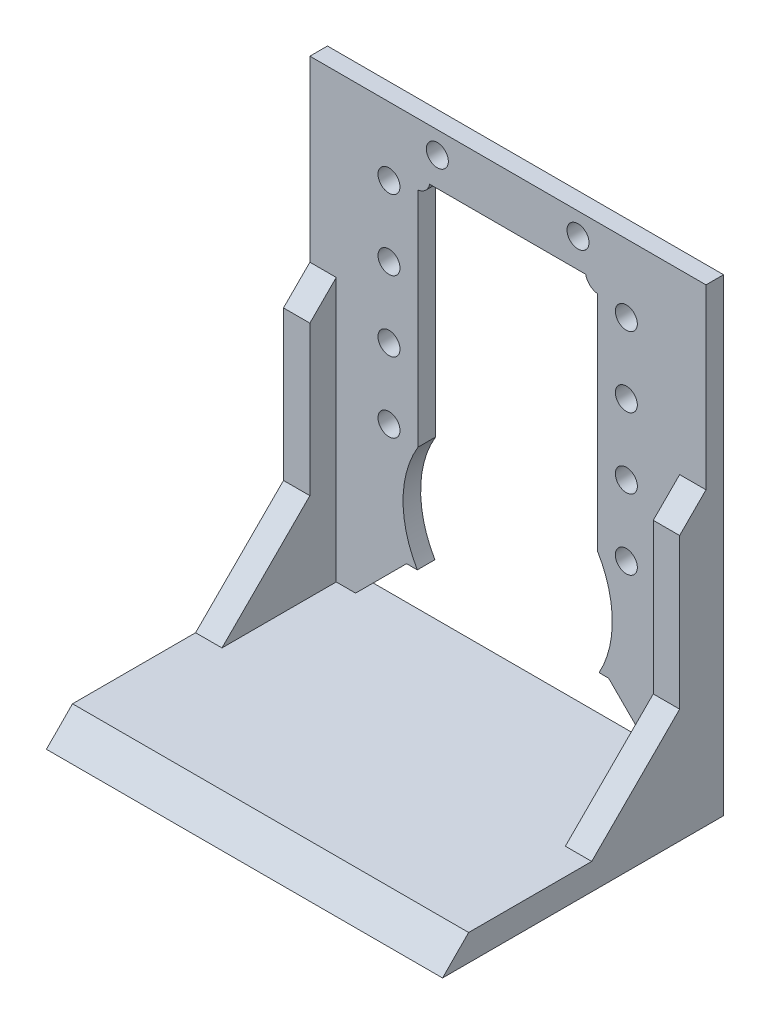
from build123d import *
from OCP.BRepFilletAPI import BRepFilletAPI_MakeChamfer
from build123d.topology import SkipClean

# Parameters (mm, degrees)
SZKIC2_R                         = 1.25
DODANIE_WYCI_GNI_CIE2_DEPTH      = 2
DODANIE_WYCI_GNI_CIE3_DEPTH      = 3
DODANIE_WYCI_GNI_CIE3_DEPTH_BACK = 2
SZKIC3_W                         = 6
SZKIC3_H                         = 30
DODANIE_WYCI_GNI_CIE4_DEPTH      = 30
DODANIE_WYCI_GNI_CIE4_DEPTH_BACK = 2
SZKIC4_W                         = 6
SZKIC4_H                         = 3
SFAZOWANIE1_SIZE                 = 8
SFAZOWANIE1_SIZE2                = 7.929766182
SFAZOWANIE1_SIZE2_2              = 8.072133677
SFAZOWANIE2_SIZE                 = 10
SFAZOWANIE3_SIZE                 = 3
SZKIC5_W                         = 38.5
SZKIC5_H                         = 53.3
SZKIC5_W_2                       = 38.438336307
SZKIC5_H_2                       = 53.191798748
WYTNIJ_WYCI_GNI_CIE1_DEPTH       = 48.5
DODANIE_WYCI_GNI_CIE5_DEPTH      = 42.061663693
WYTNIJ_WYCI_GNI_CIE2_DEPTH       = 50.5


with BuildPart() as part:
    # Szkic2 → Dodanie-wyciągnięcie2 (new body)
    with BuildSketch(Plane.XY):
        with BuildLine():
            Line((-191.460111356, 62.995312244), (-303.460111356, 62.995312244))
            Line((-303.460111356, 62.995312244), (-308.460111356, 57.995312244))
            Line((-308.460111356, 57.995312244), (-308.460111356, 23.495312244))
            Line((-308.460111356, 23.495312244), (-303.460111356, 18.495312244))
            Line((-303.460111356, 18.495312244), (-302.736783969, 18.495312244))
            ThreePointArc((-302.736783969, 18.495312244), (-304.359873615, 24.570533036), (-302.660111356, 30.624749412))
            Line((-302.660111356, 30.624749412), (-302.660111356, 55.958269629))
            ThreePointArc((-302.660111356, 55.958269629), (-301.800506396, 56.364057485), (-301.339420723, 57.195312244))
            Line((-301.339420723, 57.195312244), (-283.580801989, 57.195312244))
            ThreePointArc((-283.580801989, 57.195312244), (-283.119716316, 56.364057485), (-282.260111356, 55.958269629))
            Line((-282.260111356, 55.958269629), (-282.260111356, 30.624749412))
            ThreePointArc((-282.260111356, 30.624749412), (-280.560349096, 24.570533036), (-282.183438743, 18.495312244))
            Line((-282.183438743, 18.495312244), (-257.736783969, 18.495312244))
            ThreePointArc((-257.736783969, 18.495312244), (-259.359873615, 24.570533036), (-257.660111356, 30.624749412))
            Line((-257.660111356, 30.624749412), (-257.660111356, 55.958269629))
            ThreePointArc((-257.660111356, 55.958269629), (-256.800506396, 56.364057485), (-256.339420723, 57.195312244))
            Line((-256.339420723, 57.195312244), (-238.580801989, 57.195312244))
            ThreePointArc((-238.580801989, 57.195312244), (-238.119716316, 56.364057485), (-237.260111356, 55.958269629))
            Line((-237.260111356, 55.958269629), (-237.260111356, 30.624749412))
            ThreePointArc((-237.260111356, 30.624749412), (-235.561787998, 24.695065265), (-237.060111356, 18.711714747))
            Line((-237.060111356, 18.711714747), (-212.736783969, 18.495312244))
            ThreePointArc((-212.736783969, 18.495312244), (-214.359873615, 24.570533036), (-212.660111356, 30.624749412))
            Line((-212.660111356, 30.624749412), (-212.660111356, 55.958269629))
            ThreePointArc((-212.660111356, 55.958269629), (-211.800506396, 56.364057485), (-211.339420723, 57.195312244))
            Line((-211.339420723, 57.195312244), (-193.580801989, 57.195312244))
            ThreePointArc((-193.580801989, 57.195312244), (-193.119716316, 56.364057485), (-192.260111356, 55.958269629))
            Line((-192.260111356, 55.958269629), (-192.260111356, 30.624749412))
            ThreePointArc((-192.260111356, 30.624749412), (-190.560349096, 24.570533036), (-192.183438743, 18.495312244))
            Line((-192.183438743, 18.495312244), (-191.460111356, 18.495312244))
            Line((-191.460111356, 18.495312244), (-186.460111356, 23.495312244))
            Line((-186.460111356, 23.495312244), (-186.460111356, 57.995312244))
            Line((-186.460111356, 57.995312244), (-191.460111356, 62.995312244))
        make_face()
        with Locations((-305.960111356, 31.245312244)):
            Circle(SZKIC2_R, mode=Mode.SUBTRACT)
        with Locations((-278.960111356, 31.245312244)):
            Circle(SZKIC2_R, mode=Mode.SUBTRACT)
        with Locations((-305.960111356, 39.245312244)):
            Circle(SZKIC2_R, mode=Mode.SUBTRACT)
        with Locations((-278.960111356, 39.245312244)):
            Circle(SZKIC2_R, mode=Mode.SUBTRACT)
        with Locations((-260.960111356, 31.245312244)):
            Circle(SZKIC2_R, mode=Mode.SUBTRACT)
        with Locations((-260.960111356, 39.245312244)):
            Circle(SZKIC2_R, mode=Mode.SUBTRACT)
        with Locations((-233.960111356, 31.245312244)):
            Circle(SZKIC2_R, mode=Mode.SUBTRACT)
        with Locations((-233.960111356, 39.245312244)):
            Circle(SZKIC2_R, mode=Mode.SUBTRACT)
        with Locations((-215.960111356, 31.245312244)):
            Circle(SZKIC2_R, mode=Mode.SUBTRACT)
        with Locations((-188.960111356, 31.245312244)):
            Circle(SZKIC2_R, mode=Mode.SUBTRACT)
        with Locations((-215.960111356, 39.245312244)):
            Circle(SZKIC2_R, mode=Mode.SUBTRACT)
        with Locations((-188.960111356, 39.245312244)):
            Circle(SZKIC2_R, mode=Mode.SUBTRACT)
        with Locations((-305.960111356, 47.245312244)):
            Circle(SZKIC2_R, mode=Mode.SUBTRACT)
        with Locations((-278.960111356, 47.245312244)):
            Circle(SZKIC2_R, mode=Mode.SUBTRACT)
        with Locations((-260.960111356, 47.245312244)):
            Circle(SZKIC2_R, mode=Mode.SUBTRACT)
        with Locations((-305.960111356, 55.245312244)):
            Circle(SZKIC2_R, mode=Mode.SUBTRACT)
        with Locations((-278.960111356, 55.245312244)):
            Circle(SZKIC2_R, mode=Mode.SUBTRACT)
        with Locations((-300.460111356, 60.495312244)):
            Circle(SZKIC2_R, mode=Mode.SUBTRACT)
        with Locations((-284.460111356, 60.495312244)):
            Circle(SZKIC2_R, mode=Mode.SUBTRACT)
        with Locations((-260.960111356, 55.245312244)):
            Circle(SZKIC2_R, mode=Mode.SUBTRACT)
        with Locations((-255.460111356, 60.495312244)):
            Circle(SZKIC2_R, mode=Mode.SUBTRACT)
        with Locations((-233.960111356, 47.245312244)):
            Circle(SZKIC2_R, mode=Mode.SUBTRACT)
        with Locations((-215.960111356, 47.245312244)):
            Circle(SZKIC2_R, mode=Mode.SUBTRACT)
        with Locations((-188.960111356, 47.245312244)):
            Circle(SZKIC2_R, mode=Mode.SUBTRACT)
        with Locations((-233.960111356, 55.245312244)):
            Circle(SZKIC2_R, mode=Mode.SUBTRACT)
        with Locations((-239.460111356, 60.495312244)):
            Circle(SZKIC2_R, mode=Mode.SUBTRACT)
        with Locations((-215.960111356, 55.245312244)):
            Circle(SZKIC2_R, mode=Mode.SUBTRACT)
        with Locations((-188.960111356, 55.245312244)):
            Circle(SZKIC2_R, mode=Mode.SUBTRACT)
        with Locations((-210.460111356, 60.495312244)):
            Circle(SZKIC2_R, mode=Mode.SUBTRACT)
        with Locations((-194.460111356, 60.495312244)):
            Circle(SZKIC2_R, mode=Mode.SUBTRACT)
    extrude(amount=DODANIE_WYCI_GNI_CIE2_DEPTH)

    # Szkic3 → Dodanie-wyciągnięcie3 (add, two sides: drawn at the far end of the back side and taken through both)
    with BuildSketch(Plane.XY.offset(2).offset(-DODANIE_WYCI_GNI_CIE3_DEPTH_BACK)):
        with Locations((-269.960111356, 27.695312244)):
            Rectangle(SZKIC3_W, SZKIC3_H)
        with Locations((-224.898447663, 27.803513496)):
            Rectangle(SZKIC3_W, SZKIC3_H)
    extrude(amount=DODANIE_WYCI_GNI_CIE3_DEPTH + DODANIE_WYCI_GNI_CIE3_DEPTH_BACK)

    # Szkic4 → Dodanie-wyciągnięcie4 (add, two sides: drawn at the far end of the back side and taken through both)
    with BuildSketch(Plane.XY.offset(2).offset(-DODANIE_WYCI_GNI_CIE4_DEPTH_BACK)):
        with Locations((-269.960111356, 11.195312244)):
            Rectangle(SZKIC4_W, SZKIC4_H)
        with Locations((-224.898447663, 11.303513496)):
            Rectangle(SZKIC4_W, SZKIC4_H)
    extrude(amount=DODANIE_WYCI_GNI_CIE4_DEPTH + DODANIE_WYCI_GNI_CIE4_DEPTH_BACK)

    # Sfazowanie1: one chamfer whose edges measure the first distance from different faces: ONE call of the kernel's chamfer builder (chamfer() names one face for all edges)
    sfazowanie1_edges_1 = [part.edges().sort_by_distance(p)[0] for p in [
        (-266.960111356, 18.495312244, 1),
        (-272.960111356, 18.495312244, 1),
    ]]
    sfazowanie1_edges_2 = [part.edges().sort_by_distance(p)[0] for p in [
        (-221.898447663, 18.57682276, 1),
    ]]
    sfazowanie1_side_2 = [part.faces().sort_by_distance(p)[0] for p in [
        (-221.898447663, 14.190168128, 0.459673797),
    ]]
    sfazowanie1_edges_3 = [part.edges().sort_by_distance(p)[0] for p in [
        (-227.898447663, 18.630204232, 1),
    ]]
    sfazowanie1_side_3 = [part.faces().sort_by_distance(p)[0] for p in [
        (-227.898447663, 42.343839698, 3.5),
    ]]
    sfazowanie1 = BRepFilletAPI_MakeChamfer(part.part.solid().wrapped)
    for e in sfazowanie1_edges_1:
        sfazowanie1.Add(SFAZOWANIE1_SIZE, e.wrapped)
    for e in sfazowanie1_edges_2:
        sfazowanie1.Add(SFAZOWANIE1_SIZE, SFAZOWANIE1_SIZE2, e.wrapped, sfazowanie1_side_2[0].wrapped)  # the first distance lies on this face
    for e in sfazowanie1_edges_3:
        sfazowanie1.Add(SFAZOWANIE1_SIZE, SFAZOWANIE1_SIZE2_2, e.wrapped, sfazowanie1_side_3[0].wrapped)  # the first distance lies on this face
    add(Compound.cast(sfazowanie1.Shape()), mode=Mode.REPLACE)

    # Sfazowanie2
    sfazowanie2_edges = [part.edges().sort_by_distance(p)[0] for p in [
        (-269.960111356, 12.695312244, 5),
        (-224.898447663, 12.803513496, 5),
    ]]
    chamfer(sfazowanie2_edges, length=SFAZOWANIE2_SIZE)

    # Sfazowanie3
    sfazowanie3_edges = [part.edges().sort_by_distance(p)[0] for p in [
        (-224.898447663, 12.803513496, 32),
        (-269.960111356, 12.695312244, 32),
        (-224.898447663, 42.803513496, 5),
        (-269.960111356, 42.695312244, 5),
    ]]
    chamfer(sfazowanie3_edges, length=SFAZOWANIE3_SIZE - 0.0001)  # a hair under: the kernel refuses the full size

    # Szkic5 → Wytnij-wyciągnięcie1 (cut, symmetric)
    with BuildSketch(Plane.XY.offset(2)):
        with Locations((-289.210111356, 36.345312244)):
            Rectangle(SZKIC5_W, SZKIC5_H)
        with Locations((-205.67927951, 36.39941287)):
            Rectangle(SZKIC5_W_2, SZKIC5_H_2)
    extrude(amount=WYTNIJ_WYCI_GNI_CIE1_DEPTH, both=True, mode=Mode.SUBTRACT)

    # Szkic6 → Dodanie-wyciągnięcie5 (add)
    with SkipClean():  # the faces are left unmerged after this step: merging them gives an invalid solid
        with BuildSketch(Plane(origin=(-266.960111356, 0, 0), x_dir=(0, 0, -1), z_dir=(1, 0, 0))):
            Polygon((-32, 9.695312244), (-29, 12.695312244), (0, 12.695312244), (0, 9.695312244), align=None)
        extrude(amount=DODANIE_WYCI_GNI_CIE5_DEPTH)

    # Szkic7 → Wytnij-wyciągnięcie2 (cut, symmetric)
    with BuildSketch(Plane.ZY.offset(269.960111356)):
        Polygon((5, 22.695312244), (5, 31.42772167), (32, 31.42772167), (32, 9.664251066), (29, 12.695312244), (15, 12.695312244), align=None)
    extrude(amount=WYTNIJ_WYCI_GNI_CIE2_DEPTH, both=True, mode=Mode.SUBTRACT)


solid = part.part
